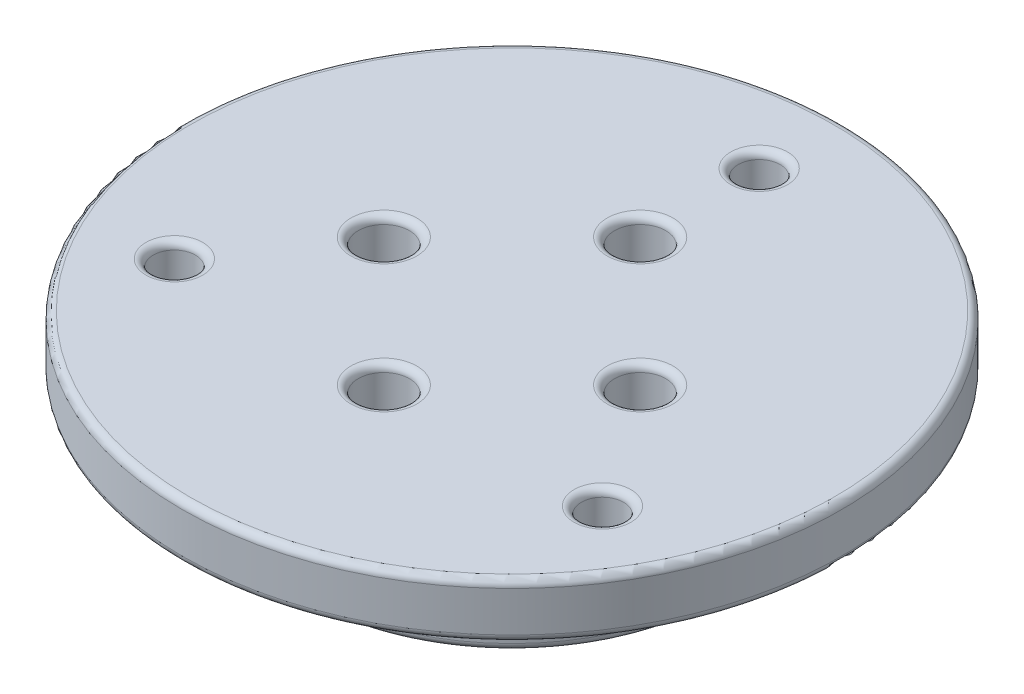
from build123d import *

# Parameters (mm, degrees)
SKETCH2_R          = 1.15
SKETCH2_R_2        = 1.4
CUT_EXTRUDE1_DEPTH = 27.683328128
FILLET2_R          = 0.4


with BuildPart() as part:
    # Sketch1 → Revolve1 (revolve)
    with BuildSketch(Plane.XY):
        Polygon((0, 0), (11.5, 0), (11.5, 5), (18, 5), (18, 8), (0, 8), align=None)
    revolve(axis=Axis((0, 0, 0), (0, 1, 0)))

    # Sketch2 → Cut-Extrude1 (cut, through all)
    with BuildSketch(Plane(origin=(0, 8, 0), x_dir=(1, 0, 0), z_dir=(0, 1, 0))):
        with Locations((0, 13.5)):
            Circle(SKETCH2_R)
        with Locations((11.691342951, -6.75)):
            Circle(SKETCH2_R)
        with Locations((-11.691342951, -6.75)):
            Circle(SKETCH2_R)
        with Locations((0, 7)):
            Circle(SKETCH2_R_2)
        with Locations((7, 0)):
            Circle(SKETCH2_R_2)
        with Locations((0, -7)):
            Circle(SKETCH2_R_2)
        with Locations((-7, 0)):
            Circle(SKETCH2_R_2)
    extrude(amount=-CUT_EXTRUDE1_DEPTH, mode=Mode.SUBTRACT)

    # Fillet2
    fillet2_edges = [part.edges().sort_by_distance(p)[0] for p in [
        (-11.5, 0, 0),
        (5.6, 0, 0),
        (-1.4, 0, -7),
        (-1.4, 0, 7),
        (-8.4, 0, 0),
        (-11.5, 5, 0),
        (-18, 5, 0),
        (-12.841342951, 5, 6.75),
        (10.541342951, 5, 6.75),
        (-1.15, 5, -13.5),
        (-18, 8, 0),
        (5.6, 8, 0),
        (-12.841342951, 8, 6.75),
        (10.541342951, 8, 6.75),
        (-1.4, 8, -7),
        (-1.4, 8, 7),
        (-8.4, 8, 0),
        (-1.15, 8, -13.5),
    ]]
    fillet(fillet2_edges, radius=FILLET2_R)


solid = part.part
